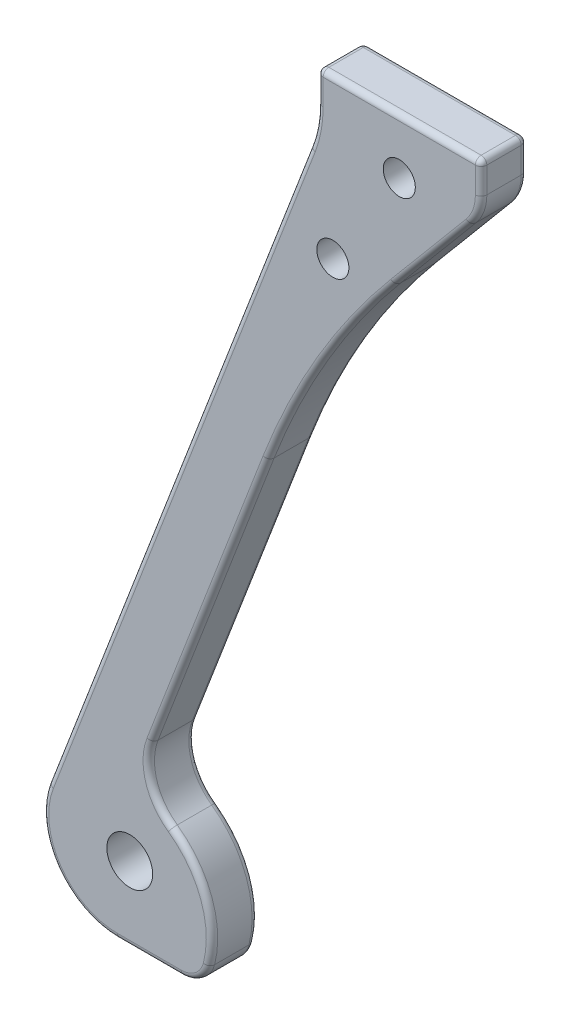
from build123d import *

# Parameters (mm, degrees)
SKETCH_1_R               = 1.4
SKETCH_1_R_2             = 2
EXTRUDE_1_DEPTH          = 4
FILLET_1_R               = 66
CUT_EXTRUDE_1_DEPTH      = 145.092986744
CUT_EXTRUDE_1_DEPTH_BACK = 145.092986744
SKETCH_2_W               = 17.6
SKETCH_2_H               = 11.1
FILLET_3_R               = 0.5
FILLET_4_R               = 0.5


with BuildPart() as part:
    # 草图1 → 凸台-拉伸1 (new body)
    with BuildSketch(Plane.XY):
        with BuildLine():
            Line((-97.873903688, 10.8), (-85.873903688, 10.8))
            ThreePointArc((-85.873903688, 10.8), (-83.8940047, 9.979898987), (-83.073903688, 8))
            ThreePointArc((-83.073903688, 8), (-83.1796222, 7.237866637), (-83.48879459, 6.53328442))
            Line((-83.48879459, 6.53328442), (-84.431683177, 5))
            ThreePointArc((-84.431683177, 5), (-84.652520599, 4.496726988), (-84.728033822, 3.952346014))
            Line((-84.728033822, 3.952346014), (-84.728033822, -3.047653986))
            ThreePointArc((-84.728033822, -3.047653986), (-84.969263339, -4.415734559), (-85.66385605, -5.618804425))
            Line((-85.66385605, -5.618804425), (-99.33833884, -21.915418417))
            Line((-99.33833884, -21.915418417), (-113.429667528, -58.624584688))
            ThreePointArc((-113.429667528, -58.624584688), (-113.541543089, -61.69465347), (-111.747141559, -64.18823756))
            ThreePointArc((-111.747141559, -64.18823756), (-108.724804348, -68.153933924), (-108.495917327, -73.134785316))
            ThreePointArc((-108.495917327, -73.134785316), (-109.387053216, -74.479515508), (-110.913984241, -75))
            Line((-110.913984241, -75), (-116.470682802, -75))
            ThreePointArc((-116.470682802, -75), (-121.827503028, -72.18164054), (-122.538955574, -66.170608328))
            Line((-122.538955574, -66.170608328), (-99.683969288, -6.631333481))
            ThreePointArc((-99.683969288, -6.631333481), (-99.187224477, -4.870009241), (-99.019773553, -3.047653986))
            Line((-99.019773553, -3.047653986), (-99.019773553, 3.952346014))
            ThreePointArc((-99.019773553, 3.952346014), (-99.095286776, 4.496726988), (-99.316124198, 5))
            Line((-99.316124198, 5), (-100.259012785, 6.53328442))
            ThreePointArc((-100.259012785, 6.53328442), (-100.568185176, 7.237866637), (-100.673903688, 8))
            ThreePointArc((-100.673903688, 8), (-99.853802675, 9.979898987), (-97.873903688, 10.8))
        make_face()
        with Locations((-85.873903688, 8)):
            Circle(SKETCH_1_R, mode=Mode.SUBTRACT)
        with Locations((-97.873903688, 8)):
            Circle(SKETCH_1_R, mode=Mode.SUBTRACT)
        with Locations((-97.673903688, -14.1)):
            Circle(SKETCH_1_R, mode=Mode.SUBTRACT)
        with Locations((-91.873903688, -5.1)):
            Circle(SKETCH_1_R, mode=Mode.SUBTRACT)
        with Locations((-115.399537808, -68.5)):
            Circle(SKETCH_1_R_2, mode=Mode.SUBTRACT)
        with BuildLine():
            Line((-88.763801636, 5.1), (-94.984005739, 5.1))
            ThreePointArc((-94.984005739, 5.1), (-95.172987976, 5.13708995), (-95.333932845, 5.242857143))
            ThreePointArc((-95.333932845, 5.242857143), (-95.615325044, 5.241421356), (-95.61676083, 4.960029158))
            ThreePointArc((-95.61676083, 4.960029158), (-95.510993638, 4.799084288), (-95.473903688, 4.610102051))
            Line((-95.473903688, 4.610102051), (-95.473903688, 0.389897949))
            ThreePointArc((-95.473903688, 0.389897949), (-95.510993638, 0.200915712), (-95.61676083, 0.039970842))
            ThreePointArc((-95.61676083, 0.039970842), (-95.615325044, -0.241421356), (-95.333932845, -0.242857143))
            ThreePointArc((-95.333932845, -0.242857143), (-95.172987976, -0.13708995), (-94.984005739, -0.1))
            Line((-94.984005739, -0.1), (-88.763801636, -0.1))
            ThreePointArc((-88.763801636, -0.1), (-88.5748194, -0.13708995), (-88.41387453, -0.242857143))
            ThreePointArc((-88.41387453, -0.242857143), (-88.132482331, -0.241421356), (-88.131046545, 0.039970842))
            ThreePointArc((-88.131046545, 0.039970842), (-88.236813737, 0.200915712), (-88.273903688, 0.389897949))
            Line((-88.273903688, 0.389897949), (-88.273903688, 4.610102051))
            ThreePointArc((-88.273903688, 4.610102051), (-88.236813737, 4.799084288), (-88.131046545, 4.960029158))
            ThreePointArc((-88.131046545, 4.960029158), (-88.132482331, 5.241421356), (-88.41387453, 5.242857143))
            ThreePointArc((-88.41387453, 5.242857143), (-88.5748194, 5.13708995), (-88.763801636, 5.1))
        make_face(mode=Mode.SUBTRACT)
    extrude(amount=EXTRUDE_1_DEPTH)

    # 圆角1
    fillet_1_edges = [part.edges().sort_by_distance(p)[0] for p in [
        (-99.33833884, -21.915418417, 2),
    ]]
    fillet(fillet_1_edges, radius=FILLET_1_R)

    # 草图2 → 切除-拉伸1 (cut, two sides: drawn at the far end of the back side and taken through both)
    with BuildSketch(Plane.XY.offset(4).offset(-CUT_EXTRUDE_1_DEPTH_BACK)):
        with Locations((-91.873903688, 5.25)):
            Rectangle(SKETCH_2_W, SKETCH_2_H)
    extrude(amount=CUT_EXTRUDE_1_DEPTH + CUT_EXTRUDE_1_DEPTH_BACK, mode=Mode.SUBTRACT)

    # 圆角3
    fillet_3_edges = [part.edges().sort_by_distance(p)[0] for p in [
        (-84.728033822, -0.3, 2),
        (-99.019773553, -0.3, 2),
    ]]
    fillet(fillet_3_edges, radius=FILLET_3_R)

    # 圆角4
    fillet_4_edges = [part.edges().sort_by_distance(p)[0] for p in [
        (-88.951427507, -9.53677952, 0),
        (-84.969263339, -4.415734559, 0),
        (-84.728033822, -1.923826993, 0),
        (-84.874480431, -0.446446609, 0),
        (-91.873903688, -0.3, 0),
        (-98.873326944, -0.446446609, 0),
        (-99.019773553, -1.923826993, 0),
        (-99.187224477, -4.870009241, 0),
        (-111.111462431, -36.400970905, 0),
        (-121.827503028, -72.18164054, 0),
        (-113.692333521, -75, 0),
        (-109.387053216, -74.479515508, 0),
        (-108.724804348, -68.153933924, 0),
        (-113.541543089, -61.69465347, 0),
        (-108.363020698, -45.425518437, 0),
        (-108.363020698, -45.425518437, 4),
        (-113.541543089, -61.69465347, 4),
        (-108.724804348, -68.153933924, 4),
        (-109.387053216, -74.479515508, 4),
        (-113.692333521, -75, 4),
        (-121.827503028, -72.18164054, 4),
        (-111.111462431, -36.400970905, 4),
        (-99.187224477, -4.870009241, 4),
        (-99.019773553, -1.923826993, 4),
        (-98.873326944, -0.446446609, 4),
        (-91.873903688, -0.3, 4),
        (-84.874480431, -0.446446609, 4),
        (-84.728033822, -1.923826993, 4),
        (-84.969263339, -4.415734559, 4),
        (-88.951427507, -9.53677952, 4),
        (-98.547590308, -22.3812049, 0),
        (-98.547590308, -22.3812049, 4),
    ]]
    fillet(fillet_4_edges, radius=FILLET_4_R)


solid = part.part
